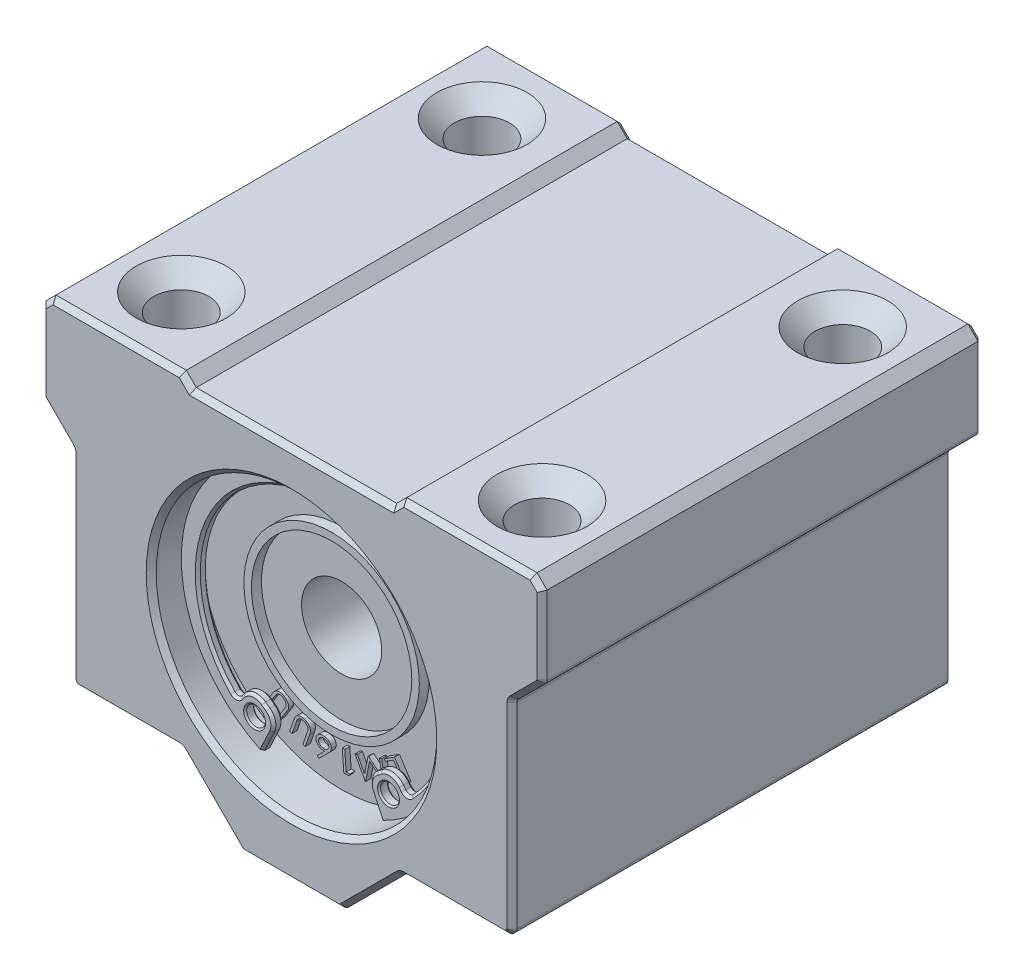
from build123d import *

# Parameters (mm, degrees)
SKETCH1_R                                    = 14
BOSS_EXTRUDE1_DEPTH                          = 22
SKETCH2_R                                    = 14
SKETCH2_R_2                                  = 4
BOSS_EXTRUDE2_DEPTH                          = 17
SKETCH3_R                                    = 8.75
SKETCH3_R_2                                  = 8
BOSS_EXTRUDE3_DEPTH                          = 1
SKETCH4_R                                    = 8.75
SKETCH4_R_2                                  = 8
BOSS_EXTRUDE4_DEPTH                          = 1
SKETCH5_R                                    = 0.943213559
BOSS_EXTRUDE5_DEPTH                          = 1
BOSS_EXTRUDE6_START                          = 1
SKETCH6_R                                    = 0.943213559
BOSS_EXTRUDE6_DEPTH                          = 1
BOSS_EXTRUDE7_DEPTH                          = 0.5
BOSS_EXTRUDE7_2_DEPTH                        = 0.5
BOSS_EXTRUDE7_3_DEPTH                        = 0.5
BOSS_EXTRUDE7_4_DEPTH                        = 0.5
BOSS_EXTRUDE7_5_DEPTH                        = 0.5
BOSS_EXTRUDE7_6_DEPTH                        = 0.5
CHAMFER1_SIZE                                = 0.5
CHAMFER2_SIZE                                = 0.5
CHAMFER3_SIZE                                = 0.25
CHAMFER4_SIZE                                = 0.15
CSK_FOR_M5_COUNTERSUNK_FLAT_HEAD_SCR_2_COUNT = 2
CSK_FOR_M5_COUNTERSUNK_FLAT_HEAD_SCR_2_PITCH = 36
CSK_FOR_M5_COUNTERSUNK_FLAT_HEAD_SCR_3_COUNT = 2
CSK_FOR_M5_COUNTERSUNK_FLAT_HEAD_SCR_3_PITCH = 46.861498055
CSK_FOR_M5_COUNTERSUNK_FLAT_HEAD_SCR_4_COUNT = 2
CSK_FOR_M5_COUNTERSUNK_FLAT_HEAD_SCR_4_PITCH = 30
CSK_FOR_M4_COUNTERSUNK_FLAT_HEAD_SCR_2_COUNT = 2
CSK_FOR_M4_COUNTERSUNK_FLAT_HEAD_SCR_2_PITCH = 34
CSK_FOR_M4_COUNTERSUNK_FLAT_HEAD_SCR_3_COUNT = 2
CSK_FOR_M4_COUNTERSUNK_FLAT_HEAD_SCR_3_PITCH = 48.083261121
CSK_FOR_M4_COUNTERSUNK_FLAT_HEAD_SCR_4_COUNT = 2
CSK_FOR_M4_COUNTERSUNK_FLAT_HEAD_SCR_4_PITCH = 34


with BuildPart() as part:
    # Sketch1 → Boss-Extrude1 (new, symmetric)
    with BuildSketch(Plane.XY):
        with BuildLine():
            Line((-24, 22.948984117), (-11, 22.948984117))
            Line((-11, 22.948984117), (-10, 21.948984117))
            Line((-10, 21.948984117), (0, 21.948984117))
            Line((0, 21.948984117), (10, 21.948984117))
            Line((10, 21.948984117), (11, 22.948984117))
            Line((11, 22.948984117), (24, 22.948984117))
            Line((24, 22.948984117), (25, 21.948984117))
            Line((25, 21.948984117), (25, 14.156090898))
            ThreePointArc((25, 14.156090898), (24.961939766, 13.964749182), (24.853553391, 13.802537507))
            Line((24.853553391, 13.802537507), (22.146446609, 11.095430726))
            ThreePointArc((22.146446609, 11.095430726), (22.038060234, 10.933219052), (22, 10.741877335))
            Line((22, 10.741877335), (22, -8.843909102))
            ThreePointArc((22, -8.843909102), (21.961939766, -9.035250818), (21.853553391, -9.197462493))
            Line((21.853553391, -9.197462493), (21.646446609, -9.404569274))
            ThreePointArc((21.646446609, -9.404569274), (21.484234935, -9.51295565), (21.292893219, -9.551015883))
            Line((21.292893219, -9.551015883), (11.207106781, -9.551015883))
            ThreePointArc((11.207106781, -9.551015883), (11.015765065, -9.589076117), (10.853553391, -9.697462493))
            Line((10.853553391, -9.697462493), (5.146446609, -15.404569274))
            ThreePointArc((5.146446609, -15.404569274), (4.984234935, -15.51295565), (4.792893219, -15.551015883))
            Line((4.792893219, -15.551015883), (-4.792893219, -15.551015883))
            ThreePointArc((-4.792893219, -15.551015883), (-4.984234935, -15.51295565), (-5.146446609, -15.404569274))
            Line((-5.146446609, -15.404569274), (-10.853553391, -9.697462493))
            ThreePointArc((-10.853553391, -9.697462493), (-11.015765065, -9.589076117), (-11.207106781, -9.551015883))
            Line((-11.207106781, -9.551015883), (-21.292893219, -9.551015883))
            ThreePointArc((-21.292893219, -9.551015883), (-21.484234935, -9.51295565), (-21.646446609, -9.404569274))
            Line((-21.646446609, -9.404569274), (-21.853553391, -9.197462493))
            ThreePointArc((-21.853553391, -9.197462493), (-21.961939766, -9.035250818), (-22, -8.843909102))
            Line((-22, -8.843909102), (-22, 10.741877335))
            ThreePointArc((-22, 10.741877335), (-22.038060234, 10.933219052), (-22.146446609, 11.095430726))
            Line((-22.146446609, 11.095430726), (-24.853553391, 13.802537507))
            ThreePointArc((-24.853553391, 13.802537507), (-24.961939766, 13.964749182), (-25, 14.156090898))
            Line((-25, 14.156090898), (-25, 21.948984117))
            Line((-25, 21.948984117), (-24, 22.948984117))
        make_face()
        with Locations((0, 3.948984117)):
            Circle(SKETCH1_R, mode=Mode.SUBTRACT)
    extrude(amount=BOSS_EXTRUDE1_DEPTH, both=True)

    # Sketch2 → Boss-Extrude2 (add, symmetric)
    with BuildSketch(Plane.XY):
        with Locations((0, 3.948984117)):
            Circle(SKETCH2_R)
        with Locations((0, 3.948984117)):
            Circle(SKETCH2_R_2, mode=Mode.SUBTRACT)
    extrude(amount=BOSS_EXTRUDE2_DEPTH, both=True)

    # Sketch4 → Boss-Extrude4 (add)
    with BuildSketch(Plane(origin=(0, 0, -17), x_dir=(-1, 0, 0), z_dir=(0, 0, -1))):
        with Locations(Location((0, 3.948984117, 0), (0, 0, 180))):
            Circle(SKETCH4_R)
        with Locations(Location((0, 3.948984117, 0), (0, 0, 180))):
            Circle(SKETCH4_R_2, mode=Mode.SUBTRACT)
    extrude(amount=BOSS_EXTRUDE4_DEPTH)

    # Sketch5 → Boss-Extrude5 (add)
    with BuildSketch(Plane.XY.offset(18)):
        with BuildLine():
            Line((5.916655664, -8.739324902), (4.949764527, -6.665820166))
            ThreePointArc((4.949764527, -6.665820166), (4.854400948, -5.666538887), (5.410577491, -4.830880499))
            Line((5.410577491, -4.830880499), (5.830306529, -4.516821293))
            ThreePointArc((5.830306529, -4.516821293), (6.942758568, -4.233149042), (7.929967521, -4.819184851))
            Line((7.929967521, -4.819184851), (8.141125185, -5.101389612))
            ThreePointArc((8.141125185, -5.101389612), (8.510436366, -5.300876484), (8.901613076, -5.148670895))
            ThreePointArc((8.901613076, -5.148670895), (0, 15.781915936), (-8.901613076, -5.148670895))
            ThreePointArc((-8.901613076, -5.148670895), (-8.510436366, -5.300876484), (-8.141125185, -5.101389612))
            Line((-8.141125185, -5.101389612), (-7.929967521, -4.819184851))
            ThreePointArc((-7.929967521, -4.819184851), (-6.942758568, -4.233149042), (-5.830306529, -4.516821293))
            Line((-5.830306529, -4.516821293), (-5.410577491, -4.830880499))
            ThreePointArc((-5.410577491, -4.830880499), (-4.854400948, -5.666538887), (-4.949764527, -6.665820166))
            Line((-4.949764527, -6.665820166), (-5.916655664, -8.739324902))
            ThreePointArc((-5.916655664, -8.739324902), (0, 17.948984117), (5.916655664, -8.739324902))
        make_face()
        with Locations((6.684982395, -6.096571527)):
            Circle(SKETCH5_R, mode=Mode.SUBTRACT)
        with Locations(Location((-6.684982395, -6.096571527, 0), (0, 0, 180))):
            Circle(SKETCH5_R, mode=Mode.SUBTRACT)
    extrude(amount=BOSS_EXTRUDE5_DEPTH)

    # Sketch6 → Boss-Extrude6 (add)
    with BuildSketch(Plane(origin=(0, 0, -18), x_dir=(-1, 0, 0), z_dir=(0, 0, -1)).offset(BOSS_EXTRUDE6_START)):
        with BuildLine():
            Line((5.916655664, -8.739324902), (4.949764527, -6.665820166))
            ThreePointArc((4.949764527, -6.665820166), (4.854400948, -5.666538887), (5.410577491, -4.830880499))
            Line((5.410577491, -4.830880499), (5.830306529, -4.516821293))
            ThreePointArc((5.830306529, -4.516821293), (6.942758568, -4.233149042), (7.929967521, -4.819184851))
            Line((7.929967521, -4.819184851), (8.141125185, -5.101389612))
            ThreePointArc((8.141125185, -5.101389612), (8.510436366, -5.300876484), (8.901613076, -5.148670895))
            ThreePointArc((8.901613076, -5.148670895), (0, 15.781915936), (-8.901613076, -5.148670895))
            ThreePointArc((-8.901613076, -5.148670895), (-8.510436366, -5.300876484), (-8.141125185, -5.101389612))
            Line((-8.141125185, -5.101389612), (-7.929967521, -4.819184851))
            ThreePointArc((-7.929967521, -4.819184851), (-6.942758568, -4.233149042), (-5.830306529, -4.516821293))
            Line((-5.830306529, -4.516821293), (-5.410577491, -4.830880499))
            ThreePointArc((-5.410577491, -4.830880499), (-4.854400948, -5.666538887), (-4.949764527, -6.665820166))
            Line((-4.949764527, -6.665820166), (-5.916655664, -8.739324902))
            ThreePointArc((-5.916655664, -8.739324902), (0, 17.948984117), (5.916655664, -8.739324902))
        make_face()
        with Locations((6.684982395, -6.096571527)):
            Circle(SKETCH6_R, mode=Mode.SUBTRACT)
        with Locations(Location((-6.684982395, -6.096571527, 0), (0, 0, 180))):
            Circle(SKETCH6_R, mode=Mode.SUBTRACT)
    extrude(amount=-BOSS_EXTRUDE6_DEPTH)

    # Chamfer1
    chamfer1_edges = [part.edges().sort_by_distance(p)[0] for p in [
        (-10.5, 22.448984117, 22),
        (10.5, 22.448984117, 22),
        (-17.5, 22.948984117, 22),
        (-24.5, 22.448984117, 22),
        (-25, 18.052537507, 22),
        (-24.961939766, 13.964749182, 22),
        (-23.5, 12.448984117, 22),
        (10.5, 22.448984117, -22),
        (-22.038060234, 10.933219052, 22),
        (17.5, 22.948984117, -22),
        (24.5, 22.448984117, -22),
        (25, 18.052537507, -22),
        (24.961939766, 13.964749182, -22),
        (23.5, 12.448984117, -22),
        (22.038060234, 10.933219052, -22),
        (22, 0.948984117, -22),
        (21.961939766, -9.035250818, -22),
        (-22, 0.948984117, 22),
        (21.75, -9.301015883, -22),
        (21.484234935, -9.51295565, -22),
        (16.25, -9.551015883, -22),
        (11.015765065, -9.589076117, -22),
        (8, -12.551015883, -22),
        (4.984234935, -15.51295565, -22),
        (0, -15.551015883, -22),
        (-21.961939766, -9.035250818, 22),
        (-4.984234935, -15.51295565, -22),
        (-8, -12.551015883, -22),
        (-11.015765065, -9.589076117, -22),
        (-16.25, -9.551015883, -22),
        (-21.484234935, -9.51295565, -22),
        (-21.75, -9.301015883, -22),
        (-21.961939766, -9.035250818, -22),
        (-22, 0.948984117, -22),
        (-21.75, -9.301015883, 22),
        (-22.038060234, 10.933219052, -22),
        (-23.5, 12.448984117, -22),
        (-24.961939766, 13.964749182, -22),
        (-25, 18.052537507, -22),
        (-24.5, 22.448984117, -22),
        (-17.5, 22.948984117, -22),
        (-10.5, 22.448984117, -22),
        (0, 21.948984117, 22),
        (-21.484234935, -9.51295565, 22),
        (0, 21.948984117, -22),
        (-16.25, -9.551015883, 22),
        (-11.015765065, -9.589076117, 22),
        (-8, -12.551015883, 22),
        (-4.984234935, -15.51295565, 22),
        (0, -15.551015883, 22),
        (4.984234935, -15.51295565, 22),
        (8, -12.551015883, 22),
        (11.015765065, -9.589076117, 22),
        (16.25, -9.551015883, 22),
        (21.484234935, -9.51295565, 22),
        (21.75, -9.301015883, 22),
        (21.961939766, -9.035250818, 22),
        (22, 0.948984117, 22),
        (22.038060234, 10.933219052, 22),
        (23.5, 12.448984117, 22),
        (24.961939766, 13.964749182, 22),
        (25, 18.052537507, 22),
        (24.5, 22.448984117, 22),
        (17.5, 22.948984117, 22),
    ]]
    chamfer(chamfer1_edges, length=CHAMFER1_SIZE - 0.0001)  # a hair under: the kernel refuses the full size

    # Chamfer2
    chamfer2_edges = [part.edges().sort_by_distance(p)[0] for p in [
        (-14, 3.948984117, -22),
        (-14, 3.948984117, 22),
    ]]
    chamfer(chamfer2_edges, length=CHAMFER2_SIZE)

    # Chamfer3
    chamfer3_edges = [part.edges().sort_by_distance(p)[0] for p in [
        (-5.433210096, -7.702572534, 19),
        (-4.854400948, -5.666538887, 19),
        (-5.62044201, -4.673850896, 19),
        (-6.942758568, -4.233149042, 19),
        (-8.035546353, -4.960287232, 19),
        (-8.510436366, -5.300876484, 19),
        (0, 15.781915936, 19),
        (8.510436366, -5.300876484, 19),
        (8.035546353, -4.960287232, 19),
        (6.942758568, -4.233149042, 19),
        (5.62044201, -4.673850896, 19),
        (4.854400948, -5.666538887, 19),
        (5.433210096, -7.702572534, 19),
        (-5.433210096, -7.702572534, 18),
        (-4.854400948, -5.666538887, 18),
        (-5.62044201, -4.673850896, 18),
        (-6.942758568, -4.233149042, 18),
        (-8.035546353, -4.960287232, 18),
        (-8.510436366, -5.300876484, 18),
        (0, 15.781915936, 18),
        (8.510436366, -5.300876484, 18),
        (8.035546353, -4.960287232, 18),
        (6.942758568, -4.233149042, 18),
        (5.62044201, -4.673850896, 18),
        (4.854400948, -5.666538887, 18),
        (5.433210096, -7.702572534, 18),
        (5.433210096, -7.702572534, -19),
        (4.854400948, -5.666538887, -19),
        (5.62044201, -4.673850896, -19),
        (6.942758568, -4.233149042, -19),
        (8.035546353, -4.960287232, -19),
        (8.510436366, -5.300876484, -19),
        (0, 15.781915936, -19),
        (-8.510436366, -5.300876484, -19),
        (-8.035546353, -4.960287232, -19),
        (-6.942758568, -4.233149042, -19),
        (-5.62044201, -4.673850896, -19),
        (-4.854400948, -5.666538887, -19),
        (-5.433210096, -7.702572534, -19),
        (5.433210096, -7.702572534, -18),
        (4.854400948, -5.666538887, -18),
        (5.62044201, -4.673850896, -18),
        (6.942758568, -4.233149042, -18),
        (8.035546353, -4.960287232, -18),
        (8.510436366, -5.300876484, -18),
        (0, 15.781915936, -18),
        (-8.510436366, -5.300876484, -18),
        (-8.035546353, -4.960287232, -18),
        (-6.942758568, -4.233149042, -18),
        (-5.62044201, -4.673850896, -18),
        (-4.854400948, -5.666538887, -18),
        (-5.433210096, -7.702572534, -18),
    ]]
    chamfer(chamfer3_edges, length=CHAMFER3_SIZE)

    # Chamfer4
    chamfer4_edges = [part.edges().sort_by_distance(p)[0] for p in [
        (5.741768835, -6.096571527, 18),
        (-5.741768835, -6.096571527, 18),
        (5.741768835, -6.096571527, 19),
        (-5.741768835, -6.096571527, 19),
        (-5.741768835, -6.096571527, -18),
        (5.741768835, -6.096571527, -18),
        (-5.741768835, -6.096571527, -19),
        (5.741768835, -6.096571527, -19),
    ]]
    chamfer(chamfer4_edges, length=CHAMFER4_SIZE)

    # Sketch9 → CSK for M5 Countersunk Flat Head Screw1 (revolve, cut)
    with BuildSketch(Plane(origin=(18, 22.948984117, 15), x_dir=(0, 0, 1), z_dir=(1, 0, 0))):
        Polygon((0, 0), (0, 13.652366702), (2.75, 12), (2.75, 1.75), (4.5, 0), align=None)
    csk_for_m5_countersunk_flat_head_screw1 = revolve(axis=Axis((18, 29.298984117, 15), (0, -1, 0)), mode=Mode.SUBTRACT)

    # CSK for M5 Countersunk Flat Head Scr 2: CSK for M5 Countersunk Flat Head Screw1 ×2
    with Locations(*[(-i * CSK_FOR_M5_COUNTERSUNK_FLAT_HEAD_SCR_2_PITCH, 0, 0) for i in range(1, CSK_FOR_M5_COUNTERSUNK_FLAT_HEAD_SCR_2_COUNT)]):
        add(csk_for_m5_countersunk_flat_head_screw1, mode=Mode.SUBTRACT)

    # CSK for M5 Countersunk Flat Head Scr 3: CSK for M5 Countersunk Flat Head Screw1 ×2
    with Locations(*[Vector(-0.768221279597376, 0, -0.6401843996644798) * (i * CSK_FOR_M5_COUNTERSUNK_FLAT_HEAD_SCR_3_PITCH) for i in range(1, CSK_FOR_M5_COUNTERSUNK_FLAT_HEAD_SCR_3_COUNT)]):
        add(csk_for_m5_countersunk_flat_head_screw1, mode=Mode.SUBTRACT)

    # CSK for M5 Countersunk Flat Head Scr 4: CSK for M5 Countersunk Flat Head Screw1 ×2
    with Locations(*[(0, 0, -i * CSK_FOR_M5_COUNTERSUNK_FLAT_HEAD_SCR_4_PITCH) for i in range(1, CSK_FOR_M5_COUNTERSUNK_FLAT_HEAD_SCR_4_COUNT)]):
        add(csk_for_m5_countersunk_flat_head_screw1, mode=Mode.SUBTRACT)

    # Sketch10 → CSK for M4 Countersunk Flat Head Screw1 (revolve, cut)
    with BuildSketch(Plane(origin=(-17, -9.551015883, 17), x_dir=(0, 0, -1), z_dir=(1, 0, 0))):
        Polygon((0, 0), (0, 13.291850331), (2.15, 12), (2.15, 1.35), (3.5, 0), align=None)
    csk_for_m4_countersunk_flat_head_screw1 = revolve(axis=Axis((-17, -15.901015883, 17), (0, 1, 0)), mode=Mode.SUBTRACT)

    # CSK for M4 Countersunk Flat Head Scr 2: CSK for M4 Countersunk Flat Head Screw1 ×2
    with Locations(*[(0, 0, -i * CSK_FOR_M4_COUNTERSUNK_FLAT_HEAD_SCR_2_PITCH) for i in range(1, CSK_FOR_M4_COUNTERSUNK_FLAT_HEAD_SCR_2_COUNT)]):
        add(csk_for_m4_countersunk_flat_head_screw1, mode=Mode.SUBTRACT)

    # CSK for M4 Countersunk Flat Head Scr 3: CSK for M4 Countersunk Flat Head Screw1 ×2
    with Locations(*[Vector(0.7071067811865476, 0, -0.7071067811865475) * (i * CSK_FOR_M4_COUNTERSUNK_FLAT_HEAD_SCR_3_PITCH) for i in range(1, CSK_FOR_M4_COUNTERSUNK_FLAT_HEAD_SCR_3_COUNT)]):
        add(csk_for_m4_countersunk_flat_head_screw1, mode=Mode.SUBTRACT)

    # CSK for M4 Countersunk Flat Head Scr 4: CSK for M4 Countersunk Flat Head Screw1 ×2
    with Locations(*[(i * CSK_FOR_M4_COUNTERSUNK_FLAT_HEAD_SCR_4_PITCH, 0, 0) for i in range(1, CSK_FOR_M4_COUNTERSUNK_FLAT_HEAD_SCR_4_COUNT)]):
        add(csk_for_m4_countersunk_flat_head_screw1, mode=Mode.SUBTRACT)


with BuildPart() as body_2:
    # Sketch3 → Boss-Extrude3 (new body)
    with BuildSketch(Plane.XY.offset(17)):
        with Locations((0, 3.948984117)):
            Circle(SKETCH3_R)
        with Locations((0, 3.948984117)):
            Circle(SKETCH3_R_2, mode=Mode.SUBTRACT)
    extrude(amount=BOSS_EXTRUDE3_DEPTH)


with BuildPart() as body_3:
    # Sketch7 → Boss-Extrude7 (new body)
    with BuildSketch(Plane.XY.offset(17)):
        Polygon((6.913986346, -5.878759257), (6.704524541, -6.013594994), (5.671631913, -4.411254583), (4.870249701, -4.928124909), (4.760006645, -4.756824161), (5.770850663, -4.105118098), align=None)
    extrude(amount=BOSS_EXTRUDE7_DEPTH)


with BuildPart() as body_4:
    # Sketch7 → Boss-Extrude7 2 (new body)
    with BuildSketch(Plane.XY.offset(17)):
        Polygon((4.49801422, -4.869393309), (4.847823916, -6.972915611), (4.809238846, -6.986059976), (3.288732703, -5.68519192), (2.901609973, -7.64285418), (2.863024904, -7.656422556), (1.839884546, -5.78441067), (2.072242986, -5.704696461), (2.793062965, -7.046693656), (3.136936496, -5.337926295), (3.196298141, -5.317573731), (4.534903243, -6.45943738), (4.270743921, -4.947835483), align=None)
    extrude(amount=BOSS_EXTRUDE7_2_DEPTH)


with BuildPart() as body_5:
    # Sketch7 → Boss-Extrude7 3 (new body)
    with BuildSketch(Plane.XY.offset(17)):
        Polygon((1.205180794, -7.985910906), (0.718839314, -8.021951905), (0.564075024, -5.916733556), (0.809577829, -5.898501051), (0.949077695, -7.797649688), (1.337896472, -7.769240901), align=None)
    extrude(amount=BOSS_EXTRUDE7_3_DEPTH)


with BuildPart() as body_6:
    # Sketch7 → Boss-Extrude7 4 (new body)
    with BuildSketch(Plane.XY.offset(17)):
        with BuildLine():
            Line((-1.756670915, -7.961095976), (-1.94662818, -7.824564192))
            Line((-1.94662818, -7.824564192), (-1.175350803, -7.051590768))
            add(Edge.make_bspline(
                [(-1.175350803, -7.051590768), (-1.198071469, -7.054893361), (-1.242527429, -7.061355319), (-1.308277086, -7.065195926), (-1.371377838, -7.065951343), (-1.412251555, -7.061721779), (-1.432301925, -7.059646991)],
                knots=[0, 0, 0, 0, 1.067845301, 2.089379297, 3.062755845, 4, 4, 4, 4], degree=3))
            add(Edge.make_bspline(
                [(-1.432301925, -7.059646991), (-1.45641145, -7.056275567), (-1.503757024, -7.049654866), (-1.572330964, -7.032265069), (-1.63746488, -7.010276826), (-1.699341343, -6.983143858), (-1.757560317, -6.950264369), (-1.812636862, -6.912419764), (-1.863971074, -6.869029864), (-1.911232969, -6.820909507), (-1.953361921, -6.769295067), (-1.989141165, -6.715098575), (-2.01886139, -6.659515261), (-2.040921696, -6.601593778), (-2.056813614, -6.542072182), (-2.065617535, -6.480616824), (-2.068008171, -6.417307496), (-2.063999181, -6.374847414), (-2.061959377, -6.353243412)],
                knots=[0, 0, 0, 0, 1.108112741, 2.17607906, 3.216367651, 4.236705303, 5.248416006, 6.257337362, 7.276130402, 8.30494211, 9.325442216, 10.305674499, 11.258833905, 12.190155537, 13.122366725, 14.059189995, 15.012501568, 16, 16, 16, 16], degree=3))
            add(Edge.make_bspline(
                [(-2.061959377, -6.353243412), (-2.059971717, -6.338352861), (-2.056041305, -6.308908191), (-2.045447432, -6.266101417), (-2.032864224, -6.224642638), (-2.017025084, -6.184715234), (-1.998562626, -6.145939187), (-1.976139008, -6.109146476), (-1.951703424, -6.073343691), (-1.924008075, -6.039343086), (-1.893504458, -6.007364914), (-1.860928407, -5.976975902), (-1.825305832, -5.949488195), (-1.787841717, -5.923533429), (-1.747528117, -5.900268474), (-1.705366272, -5.878543092), (-1.660515324, -5.859491196), (-1.597930544, -5.836981629), (-1.516702858, -5.814993449), (-1.416322434, -5.799827168), (-1.31371766, -5.79496462), (-1.245140828, -5.801350516), (-1.210543778, -5.804572205)],
                knots=[0, 0, 0, 0, 0.79887172, 1.579693987, 2.343374164, 3.10319247, 3.863457377, 4.625802967, 5.393583519, 6.16887983, 6.956303608, 7.74408653, 8.537023093, 9.348576388, 10.167727266, 11.012044694, 11.871272858, 12.758711764, 14.550403214, 16.338570588, 18.152806831, 20, 20, 20, 20], degree=3))
            add(Edge.make_bspline(
                [(-1.210543778, -5.804572205), (-1.177323058, -5.809640095), (-1.111659478, -5.819657211), (-1.016602431, -5.847219665), (-0.926572561, -5.884651339), (-0.856210832, -5.924150579), (-0.802973845, -5.959570676), (-0.765691736, -5.988321594), (-0.731261822, -6.019198253), (-0.698775906, -6.051181757), (-0.669615971, -6.085766282), (-0.642811192, -6.121851897), (-0.618454269, -6.159756808), (-0.590234406, -6.21217086), (-0.561090688, -6.279595768), (-0.540200207, -6.363465569), (-0.530110064, -6.448520987), (-0.534837017, -6.505038658), (-0.537213116, -6.533448406)],
                knots=[0, 0, 0, 0, 1.46073837, 2.887273584, 4.292984298, 5.694074783, 6.389868125, 7.073685632, 7.740058012, 8.400932623, 9.055195159, 9.705748825, 10.355604721, 11.013181605, 12.294509825, 13.53827119, 14.762562279, 16, 16, 16, 16], degree=3))
            add(Edge.make_bspline(
                [(-0.537213116, -6.533448406), (-0.540691727, -6.554894), (-0.547789188, -6.598649769), (-0.567881449, -6.663887266), (-0.595827676, -6.729698484), (-0.624727413, -6.78489029), (-0.652953172, -6.829501387), (-0.676905191, -6.86538017), (-0.705309945, -6.901817541), (-0.73555914, -6.940847668), (-0.770103347, -6.98034419), (-0.807529857, -7.021650616), (-0.848121841, -7.064473773), (-0.876906186, -7.092941927), (-0.891686941, -7.107560319)],
                knots=[0, 0, 0, 0, 1.136479283, 2.318775931, 3.562582394, 4.876779956, 5.57491363, 6.32613439, 7.134248662, 7.992959139, 8.911210621, 9.880411115, 10.911591512, 12, 12, 12, 12], degree=3))
            Line((-0.891686941, -7.107560319), (-1.756670915, -7.961095976))
        make_face()
        with BuildLine():
            add(Edge.make_bspline(
                [(-1.35131568, -6.883682114), (-1.333664795, -6.885406788), (-1.29884151, -6.888809384), (-1.247079731, -6.888465748), (-1.196675989, -6.885016237), (-1.147871479, -6.876378924), (-1.100462976, -6.863631504), (-1.054714339, -6.846546072), (-1.010107767, -6.82577333), (-0.967939363, -6.800365835), (-0.928147798, -6.772448825), (-0.892888684, -6.741331902), (-0.86190852, -6.708149229), (-0.836051775, -6.67221539), (-0.814164506, -6.634394338), (-0.797099751, -6.594109757), (-0.784590405, -6.551554865), (-0.7802479, -6.522070586), (-0.778051791, -6.507159678)],
                knots=[0, 0, 0, 0, 1.116906772, 2.203536113, 3.257590824, 4.297247275, 5.321374118, 6.347165046, 7.371136954, 8.417486704, 9.445633688, 10.430147147, 11.375611188, 12.300246635, 13.213877464, 14.12376692, 15.05114381, 16, 16, 16, 16], degree=3))
            add(Edge.make_bspline(
                [(-0.778051791, -6.507159678), (-0.776752889, -6.492193621), (-0.774193638, -6.462705744), (-0.775746273, -6.418656184), (-0.783348546, -6.37577893), (-0.795057995, -6.333924839), (-0.811782181, -6.292973134), (-0.834079505, -6.253655361), (-0.861059096, -6.215185246), (-0.89255442, -6.178242004), (-0.928034473, -6.143962345), (-0.965606957, -6.112169381), (-1.006400731, -6.085120969), (-1.049127639, -6.061038604), (-1.094952254, -6.041764459), (-1.142742436, -6.025443724), (-1.193211301, -6.013614779), (-1.227743893, -6.008553016), (-1.245312742, -6.005977787)],
                knots=[0, 0, 0, 0, 0.947386657, 1.866652136, 2.771265639, 3.688799104, 4.604640703, 5.554877406, 6.534620308, 7.565780037, 8.612670133, 9.644909127, 10.666459884, 11.696384783, 12.735075813, 13.798286566, 14.87985323, 16, 16, 16, 16], degree=3))
            add(Edge.make_bspline(
                [(-1.245312742, -6.005977787), (-1.262962046, -6.004321017), (-1.297782788, -6.001052335), (-1.349579199, -6.000421746), (-1.399878309, -6.004984883), (-1.448813334, -6.012654481), (-1.496138976, -6.025694678), (-1.542043806, -6.042557131), (-1.586362952, -6.064046691), (-1.628839167, -6.089028582), (-1.667773259, -6.117892335), (-1.70366438, -6.148247249), (-1.733975225, -6.181925272), (-1.760327695, -6.217454755), (-1.781894709, -6.255196749), (-1.79921407, -6.295218437), (-1.811543234, -6.337557421), (-1.815939524, -6.366887442), (-1.818152619, -6.381652199)],
                knots=[0, 0, 0, 0, 1.118470674, 2.206658076, 3.262904438, 4.302525524, 5.328086358, 6.355313606, 7.384552448, 8.432367306, 9.459942997, 10.439967365, 11.393328358, 12.312056388, 13.22696649, 14.129929627, 15.058605038, 16, 16, 16, 16], degree=3))
            add(Edge.make_bspline(
                [(-1.818152619, -6.381652199), (-1.819450738, -6.396618694), (-1.822020654, -6.426248217), (-1.820443786, -6.470574123), (-1.812922279, -6.513751997), (-1.801076413, -6.555852934), (-1.78445323, -6.596892017), (-1.7626185, -6.636546402), (-1.73554329, -6.674887624), (-1.704060121, -6.711818248), (-1.668741793, -6.746165673), (-1.630850683, -6.777407123), (-1.590388617, -6.804691155), (-1.547247238, -6.827950553), (-1.501902016, -6.848200663), (-1.453709045, -6.863485121), (-1.403501878, -6.876230316), (-1.368902025, -6.881170915), (-1.35131568, -6.883682114)],
                knots=[0, 0, 0, 0, 0.946528487, 1.873864729, 2.786444109, 3.703146446, 4.626407219, 5.571466755, 6.550322177, 7.580547852, 8.626489644, 9.652119954, 10.67274536, 11.697446376, 12.738747798, 13.798189091, 14.880867891, 16, 16, 16, 16], degree=3))
        make_face(mode=Mode.SUBTRACT)
    extrude(amount=BOSS_EXTRUDE7_4_DEPTH)


with BuildPart() as body_7:
    # Sketch7 → Boss-Extrude7 5 (new body)
    with BuildSketch(Plane.XY.offset(17)):
        with BuildLine():
            Line((-3.121913349, -7.631220817), (-3.357663883, -7.550234572))
            Line((-3.357663883, -7.550234572), (-2.944252424, -6.349857302))
            add(Edge.make_bspline(
                [(-2.944252424, -6.349857302), (-2.93843739, -6.332903815), (-2.927402022, -6.300730666), (-2.9120077, -6.254835952), (-2.898951845, -6.213631058), (-2.887533793, -6.177482814), (-2.878038053, -6.146292742), (-2.870733491, -6.120016746), (-2.865653404, -6.09848307), (-2.86309766, -6.08570369), (-2.861994144, -6.080185828)],
                knots=[0, 0, 0, 0, 1.524716503, 2.893500993, 4.117897137, 5.201684942, 6.118396562, 6.891371258, 7.521317877, 8, 8, 8, 8], degree=3))
            add(Edge.make_bspline(
                [(-2.861994144, -6.080185828), (-2.858954815, -6.060164711), (-2.85302761, -6.02112015), (-2.852622131, -5.963059908), (-2.859706143, -5.907786485), (-2.874847868, -5.854828221), (-2.89880908, -5.80332458), (-2.932434606, -5.752681018), (-2.975811076, -5.702529094), (-3.027713233, -5.654077187), (-3.085198196, -5.608527508), (-3.14640214, -5.56846892), (-3.210280487, -5.534916215), (-3.254864371, -5.517935531), (-3.27710165, -5.509466009)],
                knots=[0, 0, 0, 0, 0.943500343, 1.839985138, 2.697656204, 3.534272983, 4.398404178, 5.336292591, 6.360118087, 7.483888112, 8.643058115, 9.776587096, 10.891019629, 12, 12, 12, 12], degree=3))
            add(Edge.make_bspline(
                [(-3.27710165, -5.509466009), (-3.296639089, -5.503260613), (-3.335398384, -5.490950054), (-3.395171361, -5.479808964), (-3.455311335, -5.473779898), (-3.515532762, -5.473198421), (-3.574548007, -5.47888811), (-3.631378834, -5.489125819), (-3.685082172, -5.505893526), (-3.735788051, -5.527915238), (-3.783232059, -5.555642279), (-3.826929942, -5.589072447), (-3.86797629, -5.627198051), (-3.891168497, -5.656822442), (-3.902942996, -5.67186251)],
                knots=[0, 0, 0, 0, 1.064589341, 2.111982648, 3.152863923, 4.203369694, 5.236236065, 6.230366549, 7.199288887, 8.153281384, 9.098208466, 10.047323786, 11.008641791, 12, 12, 12, 12], degree=3))
            add(Edge.make_bspline(
                [(-3.902942996, -5.67186251), (-3.90744205, -5.678290383), (-3.917424071, -5.692551858), (-3.930912651, -5.717661353), (-3.945902272, -5.747630529), (-3.961988801, -5.782803496), (-3.978767198, -5.823461664), (-3.996571026, -5.869268678), (-4.015120897, -5.920247837), (-4.02777106, -5.955940781), (-4.034386639, -5.974606901)],
                knots=[0, 0, 0, 0, 0.568617248, 1.261587164, 2.063836428, 2.999580257, 4.065659825, 5.253510769, 6.563685271, 8, 8, 8, 8], degree=3))
            Line((-4.034386639, -5.974606901), (-4.447798097, -7.174984172))
            Line((-4.447798097, -7.174984172), (-4.683548632, -7.093573915))
            Line((-4.683548632, -7.093573915), (-4.270137173, -5.893196645))
            add(Edge.make_bspline(
                [(-4.270137173, -5.893196645), (-4.262489991, -5.871666998), (-4.247516084, -5.829509909), (-4.223489655, -5.768632134), (-4.198405295, -5.711656347), (-4.172638655, -5.65854443), (-4.1458015, -5.609457011), (-4.119016166, -5.563750335), (-4.090216088, -5.522591566), (-4.061048679, -5.4843301), (-4.029254123, -5.449433475), (-3.994312919, -5.417736677), (-3.956480197, -5.388063401), (-3.914626486, -5.361962312), (-3.86956693, -5.338145706), (-3.821060695, -5.317006117), (-3.769273886, -5.298273986), (-3.714420484, -5.282814921), (-3.657439356, -5.270328789), (-3.598723569, -5.262587759), (-3.538869018, -5.260361887), (-3.477935492, -5.261927477), (-3.416001525, -5.268370077), (-3.352993154, -5.279564776), (-3.2887854, -5.295163412), (-3.246206261, -5.309046918), (-3.224524193, -5.31611665)],
                knots=[0, 0, 0, 0, 1.203650554, 2.356861848, 3.44709913, 4.482800659, 5.465737061, 6.394135473, 7.271975095, 8.110532696, 8.927487735, 9.754962809, 10.593520411, 11.457031413, 12.349715165, 13.276649201, 14.24237097, 15.248830725, 16.277009939, 17.313300193, 18.364175016, 19.429408722, 20.522287408, 21.641212451, 22.79886265, 24, 24, 24, 24], degree=3))
            add(Edge.make_bspline(
                [(-3.224524193, -5.31611665), (-3.201233231, -5.324452919), (-3.155412287, -5.340853087), (-3.089716631, -5.369939294), (-3.027671184, -5.401263784), (-2.96930921, -5.435145487), (-2.915008034, -5.472124758), (-2.864412651, -5.511607694), (-2.817461035, -5.553644864), (-2.77491869, -5.598531461), (-2.736363357, -5.644883544), (-2.702707278, -5.692487879), (-2.674084101, -5.740947359), (-2.650664912, -5.790519949), (-2.631777442, -5.840778352), (-2.618766288, -5.89229248), (-2.609885788, -5.94434578), (-2.608352591, -5.979518456), (-2.607587093, -5.997079524)],
                knots=[0, 0, 0, 0, 1.213599595, 2.387547538, 3.522811033, 4.623151502, 5.696582328, 6.74408888, 7.770511178, 8.78600225, 9.776165607, 10.726769756, 11.64389136, 12.534292864, 13.414260253, 14.273874986, 15.138177648, 16, 16, 16, 16], degree=3))
            add(Edge.make_bspline(
                [(-2.607587093, -5.997079524), (-2.607671741, -6.008962021), (-2.607853625, -6.034494124), (-2.612568042, -6.075422564), (-2.620370742, -6.121484233), (-2.630910505, -6.173055469), (-2.645588957, -6.229817968), (-2.663585692, -6.292065779), (-2.684066458, -6.359969779), (-2.700138963, -6.406587288), (-2.70850189, -6.430843547)],
                knots=[0, 0, 0, 0, 0.637416553, 1.369626672, 2.207715167, 3.145025956, 4.193780982, 5.353567928, 6.622995005, 8, 8, 8, 8], degree=3))
            Line((-2.70850189, -6.430843547), (-3.121913349, -7.631220817))
        make_face()
    extrude(amount=BOSS_EXTRUDE7_5_DEPTH)


with BuildPart() as body_8:
    # Sketch7 → Boss-Extrude7 6 (new body)
    with BuildSketch(Plane.XY.offset(17)):
        with BuildLine():
            Line((-5.671022363, -6.611301076), (-5.881332192, -6.479009409))
            Line((-5.881332192, -6.479009409), (-5.207153506, -5.408379735))
            add(Edge.make_bspline(
                [(-5.207153506, -5.408379735), (-5.197679343, -5.393259712), (-5.179645728, -5.364479476), (-5.154076415, -5.323512865), (-5.132142599, -5.286380393), (-5.112690645, -5.254015481), (-5.096144573, -5.225970798), (-5.083891005, -5.201683533), (-5.073213185, -5.18241725), (-5.068144977, -5.170544955), (-5.065957593, -5.165421001)],
                knots=[0, 0, 0, 0, 1.52286174, 2.898694104, 4.12131611, 5.203264608, 6.121930434, 6.89892017, 7.524785785, 8, 8, 8, 8], degree=3))
            add(Edge.make_bspline(
                [(-5.065957593, -5.165421001), (-5.058388736, -5.146509562), (-5.043691106, -5.109786268), (-5.030492509, -5.053244528), (-5.02527523, -4.997892097), (-5.027714215, -4.943011253), (-5.038970036, -4.887551342), (-5.060546568, -4.831159117), (-5.091076228, -4.772849297), (-5.130113212, -4.713845266), (-5.175185561, -4.656364526), (-5.225750399, -4.603862989), (-5.2798681, -4.556737892), (-5.319361641, -4.530278349), (-5.339021161, -4.517107032)],
                knots=[0, 0, 0, 0, 0.952296582, 1.849222911, 2.706232397, 3.547264958, 4.411266404, 5.342656368, 6.363371736, 7.486215149, 8.649483226, 9.776993344, 10.893407783, 12, 12, 12, 12], degree=3))
            add(Edge.make_bspline(
                [(-5.339021161, -4.517107032), (-5.356638194, -4.506573502), (-5.391585936, -4.485677642), (-5.447105226, -4.460791473), (-5.504256212, -4.441003339), (-5.562832976, -4.427339067), (-5.62126356, -4.418574763), (-5.678840093, -4.416503296), (-5.734723858, -4.420173416), (-5.789031476, -4.430059093), (-5.8414304, -4.445544932), (-5.891519798, -4.468115805), (-5.939853946, -4.496403405), (-5.969373344, -4.519974861), (-5.984367048, -4.531947443)],
                knots=[0, 0, 0, 0, 1.067213431, 2.117081781, 3.158961113, 4.209576124, 5.242305582, 6.228423885, 7.201402189, 8.150549295, 9.095127126, 10.036694319, 11.002783751, 12, 12, 12, 12], degree=3))
            add(Edge.make_bspline(
                [(-5.984367048, -4.531947443), (-5.990111244, -4.537084623), (-6.002868861, -4.548494082), (-6.021724228, -4.569595731), (-6.042810262, -4.595439912), (-6.066015255, -4.626182665), (-6.092088718, -4.66117772), (-6.119414558, -4.701835875), (-6.149568415, -4.746850544), (-6.169743858, -4.778950421), (-6.180260477, -4.795682753)],
                knots=[0, 0, 0, 0, 0.561131323, 1.246248913, 2.058498528, 2.991547721, 4.052307649, 5.237714281, 6.560135293, 8, 8, 8, 8], degree=3))
            Line((-6.180260477, -4.795682753), (-6.854439163, -5.866312427))
            Line((-6.854439163, -5.866312427), (-7.064748992, -5.73402076))
            Line((-7.064748992, -5.73402076), (-6.390570306, -4.663391086))
            add(Edge.make_bspline(
                [(-6.390570306, -4.663391086), (-6.378260575, -4.644225599), (-6.354211037, -4.606781964), (-6.316832026, -4.553352146), (-6.279563673, -4.503658244), (-6.242375007, -4.457958197), (-6.205388858, -4.416147371), (-6.168476298, -4.378343674), (-6.131718664, -4.344285672), (-6.09435537, -4.314207459), (-6.055832067, -4.287310682), (-6.014636892, -4.264622624), (-5.970841644, -4.244877843), (-5.924513825, -4.228367909), (-5.87519742, -4.215838288), (-5.823562681, -4.205829331), (-5.769080661, -4.20034209), (-5.712477269, -4.197044992), (-5.654338268, -4.198322752), (-5.595656525, -4.204328818), (-5.536900977, -4.214855293), (-5.478298662, -4.230786991), (-5.419625302, -4.25116269), (-5.360971728, -4.276502245), (-5.301876373, -4.305822077), (-5.263799591, -4.329247941), (-5.24446654, -4.341142155)],
                knots=[0, 0, 0, 0, 1.203738211, 2.351744798, 3.445313106, 4.485939472, 5.464815106, 6.394487944, 7.277338291, 8.111442372, 8.927797887, 9.757071597, 10.59287974, 11.464663812, 12.352430126, 13.279789407, 14.241615814, 15.243923352, 16.274988524, 17.311101153, 18.358701356, 19.425930929, 20.51732862, 21.63840921, 22.800929304, 24, 24, 24, 24], degree=3))
            add(Edge.make_bspline(
                [(-5.24446654, -4.341142155), (-5.223797765, -4.354456948), (-5.18309006, -4.380680791), (-5.125984508, -4.423761421), (-5.072780181, -4.468065671), (-5.024351137, -4.51466686), (-4.97962249, -4.562316446), (-4.939617879, -4.612382875), (-4.903465729, -4.663893226), (-4.872163475, -4.717301538), (-4.845669895, -4.771412732), (-4.823251078, -4.825187246), (-4.806665315, -4.878890119), (-4.795230736, -4.932250675), (-4.788057804, -4.985287944), (-4.787190223, -5.03810978), (-4.790018391, -5.090743241), (-4.796727243, -5.125193624), (-4.800102224, -5.142524366)],
                knots=[0, 0, 0, 0, 1.209526493, 2.382194797, 3.517639315, 4.614663784, 5.687543513, 6.731421432, 7.765615068, 8.781949389, 9.774223196, 10.728725683, 11.64611672, 12.535582631, 13.412091336, 14.274803779, 15.132116129, 16, 16, 16, 16], degree=3))
            add(Edge.make_bspline(
                [(-4.800102224, -5.142524366), (-4.802862914, -5.154033809), (-4.808806077, -5.178811127), (-4.823037669, -5.217390546), (-4.840802045, -5.2605452), (-4.862858079, -5.30823965), (-4.890389151, -5.359802134), (-4.921779548, -5.416198229), (-4.957261562, -5.477302809), (-4.983294317, -5.518979689), (-4.996843677, -5.540671401)],
                knots=[0, 0, 0, 0, 0.636603931, 1.370469398, 2.209674013, 3.149104618, 4.197213417, 5.355122379, 6.623411197, 8, 8, 8, 8], degree=3))
            Line((-4.996843677, -5.540671401), (-5.671022363, -6.611301076))
        make_face()
    extrude(amount=BOSS_EXTRUDE7_6_DEPTH)


solid = Compound([part.part, body_2.part, body_3.part, body_4.part, body_5.part, body_6.part, body_7.part, body_8.part])
